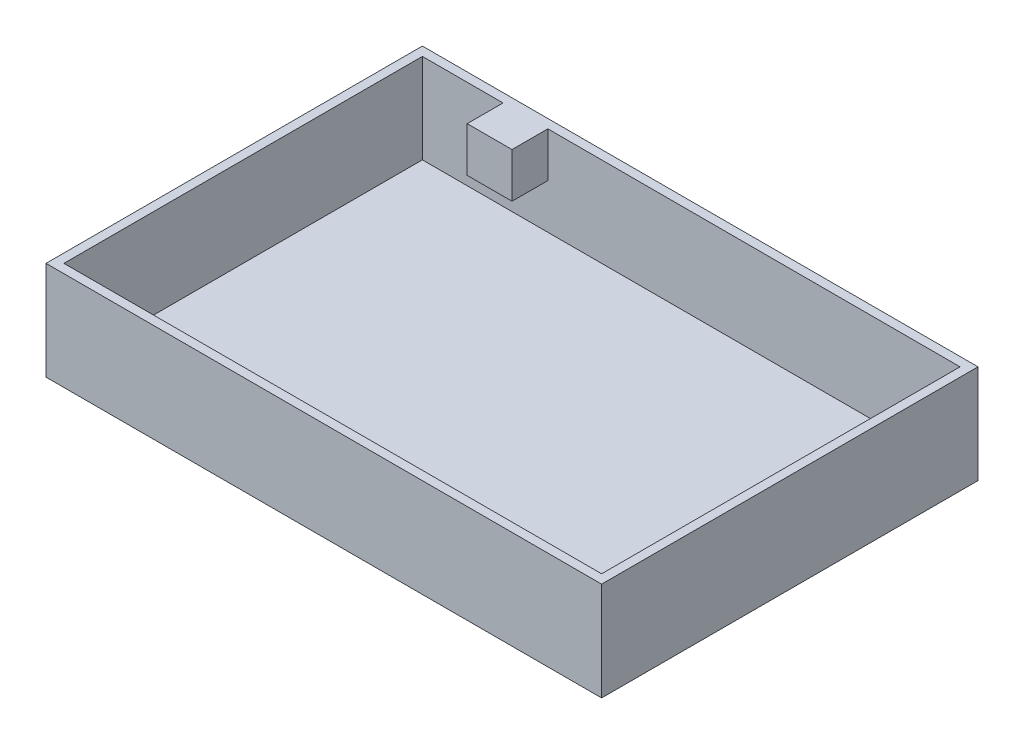
from build123d import *

# Parameters (mm, degrees)
SKETCH1_W           = 124
SKETCH1_H           = 84
SKETCH1_W_2         = 120
SKETCH1_H_2         = 80
EXTRUDE_THIN1_DEPTH = 20
SKETCH2_W           = 124
SKETCH2_H           = 84
BOSS_EXTRUDE1_DEPTH = 2
SKETCH3_W           = 10
SKETCH3_H           = 10
BOSS_EXTRUDE2_DEPTH = 8


with BuildPart() as part:
    # Sketch1 → Extrude-Thin1 (new body)
    with BuildSketch(Plane(origin=(0, 0, 0), x_dir=(1, 0, 0), z_dir=(0, 1, 0))):
        Rectangle(SKETCH1_W, SKETCH1_H)
        Rectangle(SKETCH1_W_2, SKETCH1_H_2, mode=Mode.SUBTRACT)
    extrude(amount=EXTRUDE_THIN1_DEPTH)

    # Sketch2 → Boss-Extrude1 (add)
    with BuildSketch(Plane.XZ):
        Rectangle(SKETCH2_W, SKETCH2_H)
    extrude(amount=BOSS_EXTRUDE1_DEPTH)

    # Sketch3 → Boss-Extrude2 (add)
    with BuildSketch(Plane.XY.offset(-40)):
        with Locations((-37, 15)):
            Rectangle(SKETCH3_W, SKETCH3_H)
    extrude(amount=BOSS_EXTRUDE2_DEPTH)


solid = part.part
